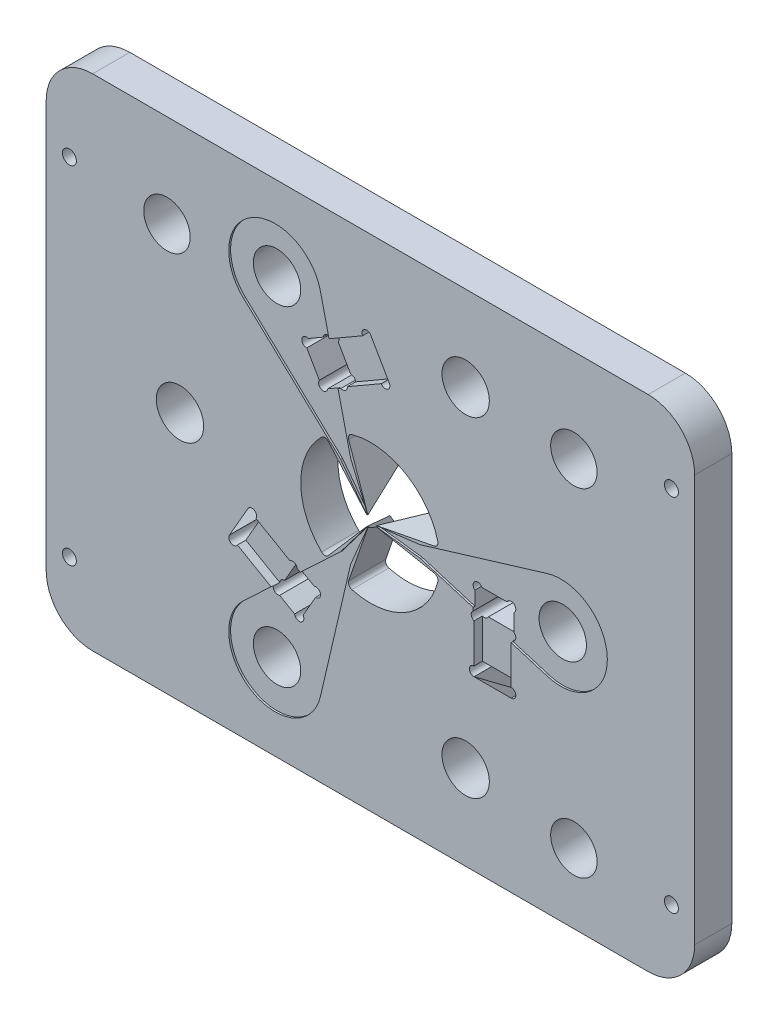
from build123d import *
from build123d.topology import SkipClean

# Parameters (mm, degrees)
SKETCH_1_W           = 76
SKETCH_1_H           = 60
EXTRUDE_1_DEPTH      = 4
CUT_EXTRUDE_1_DEPTH  = 0.5
SKETCH_3_R           = 2.55
CUT_EXTRUDE_2_DEPTH  = 49.541219597
SKETCH_5_R           = 2.55
CUT_EXTRUDE_4_DEPTH  = 49.579831206
SKETCH_6_W           = 76
SKETCH_6_H           = 60
CUT_EXTRUDE_5_DEPTH  = 10
CUT_EXTRUDE_6_DEPTH  = 45.244999717
SKETCH_8_R           = 0.75
CUT_EXTRUDE_7_DEPTH  = 45.244999717
EXTRUDE_START        = 0.5
SKETCH_10_R          = 2.55
EXTRUDE_2_DEPTH      = 0.5
CUT_EXTRUDE_9_DEPTH  = 45.244999717
SKETCH_13_R          = 2.5
CUT_EXTRUDE_10_DEPTH = 45.244999717
SKETCH_14_W          = 4
SKETCH_14_H          = 4.45
CUT_EXTRUDE_11_DEPTH = 0.9
CUT_EXTRUDE_12_DEPTH = 0.2
CUT_EXTRUDE_15_DEPTH = 4
CUT_EXTRUDE_16_DEPTH = 4
CUT_EXTRUDE_17_DEPTH = 4


with BuildPart() as part:
    # 草圖1 → 填料-伸長1 (new body)
    with BuildSketch(Plane.XY):
        Rectangle(SKETCH_1_W, SKETCH_1_H)
    extrude(amount=EXTRUDE_1_DEPTH)

    # 草圖2 → 除料-伸長1 (cut)
    with BuildSketch(Plane.XY.offset(4)):
        with BuildLine():
            Line((0.357380647, 0.004961492), (4.50941379, 0.523267787))
            ThreePointArc((4.50941379, 0.523267787), (5.349803134, 0.664770922), (6.175092484, 0.877314741))
            Line((6.175092484, 0.877314741), (19.047808057, 4.784468472))
            ThreePointArc((19.047808057, 4.784468472), (25.5, 0), (19.047808057, -4.784468472))
            Line((19.047808057, -4.784468472), (6.175092484, -0.877314741))
            ThreePointArc((6.175092484, -0.877314741), (5.349803134, -0.664770922), (4.50941379, -0.523267787))
            Line((4.50941379, -0.523267787), (0.357380647, -0.004961492))
            ThreePointArc((0.357380647, -0.004961492), (0.353, 0), (0.357380647, 0.004961492))
        make_face()
        with BuildLine():
            Line((-2.327769389, -5.786444332), (-5.380432788, -18.8881199))
            ThreePointArc((-5.380432788, -18.8881199), (-12.75, -22.083647797), (-13.667375269, -14.103651428))
            Line((-13.667375269, -14.103651428), (-3.847323094, -4.909129591))
            ThreePointArc((-3.847323094, -4.909129591), (-3.250610073, -4.300679958), (-2.707870091, -3.643633005))
            Line((-2.707870091, -3.643633005), (-0.182987102, -0.307019973))
            ThreePointArc((-0.182987102, -0.307019973), (-0.1765, -0.305706968), (-0.174393546, -0.311981465))
            Line((-0.174393546, -0.311981465), (-1.801543699, -4.166900792))
            ThreePointArc((-1.801543699, -4.166900792), (-2.09919306, -4.96545088), (-2.327769389, -5.786444332))
        make_face()
        with BuildLine():
            Line((-3.847323094, 4.909129591), (-13.667375269, 14.103651428))
            ThreePointArc((-13.667375269, 14.103651428), (-12.75, 22.083647797), (-5.380432788, 18.8881199))
            Line((-5.380432788, 18.8881199), (-2.327769389, 5.786444332))
            ThreePointArc((-2.327769389, 5.786444332), (-2.09919306, 4.96545088), (-1.801543699, 4.166900792))
            Line((-1.801543699, 4.166900792), (-0.174393546, 0.311981465))
            ThreePointArc((-0.174393546, 0.311981465), (-0.1765, 0.305706968), (-0.182987102, 0.307019973))
            Line((-0.182987102, 0.307019973), (-2.707870091, 3.643633005))
            ThreePointArc((-2.707870091, 3.643633005), (-3.250610073, 4.300679958), (-3.847323094, 4.909129591))
        make_face()
    extrude(amount=-CUT_EXTRUDE_1_DEPTH, mode=Mode.SUBTRACT)

    # 草圖3 → 除料-伸長2 (cut, through all)
    with BuildSketch(Plane.XY.offset(3.5)):
        with Locations((20.5, 0)):
            Circle(SKETCH_3_R)
        with Locations((-10.25, -17.753520778)):
            Circle(SKETCH_3_R)
        with Locations((-10.25, 17.753520778)):
            Circle(SKETCH_3_R)
    extrude(amount=-CUT_EXTRUDE_2_DEPTH, mode=Mode.SUBTRACT)

    # 草圖5 → 除料-伸長4 (cut, through all)
    with BuildSketch(Plane.XY.offset(4)):
        with Locations((-20.5, 0)):
            Circle(SKETCH_5_R)
        with Locations((10.25, 17.753520778)):
            Circle(SKETCH_5_R)
        with Locations((10.25, -17.753520778)):
            Circle(SKETCH_5_R)
    extrude(amount=-CUT_EXTRUDE_4_DEPTH, mode=Mode.SUBTRACT)

    # 草圖6 → 除料-伸長5 (cut)
    with BuildSketch(Plane.XY.offset(4)):
        Rectangle(SKETCH_6_W, SKETCH_6_H)
        with BuildLine():
            ThreePointArc((-34.9, 21.9), (-33.435533906, 25.435533906), (-29.9, 26.9))
            Line((-29.9, 26.9), (29.9, 26.9))
            ThreePointArc((29.9, 26.9), (33.435533906, 25.435533906), (34.9, 21.9))
            Line((34.9, 21.9), (34.9, -21.9))
            ThreePointArc((34.9, -21.9), (33.435533906, -25.435533906), (29.9, -26.9))
            Line((29.9, -26.9), (-29.9, -26.9))
            ThreePointArc((-29.9, -26.9), (-33.435533906, -25.435533906), (-34.9, -21.9))
            Line((-34.9, -21.9), (-34.9, 21.9))
        make_face(mode=Mode.SUBTRACT)
    extrude(amount=-CUT_EXTRUDE_5_DEPTH, mode=Mode.SUBTRACT)

    # 草圖7 → 除料-伸長6 (cut, through all)
    with BuildSketch(Plane.XY.offset(4)):
        with BuildLine():
            ThreePointArc((11.798296094, -0.228571429), (11.03056096, -0.065346), (11.05, -0.85))
            Line((11.05, -0.85), (11.05, -2.707142857))
            ThreePointArc((11.05, -2.707142857), (11.03056096, -3.491796857), (11.798296094, -3.328571429))
            Line((11.798296094, -3.328571429), (14.501703906, -3.328571429))
            ThreePointArc((14.501703906, -3.328571429), (15.26943904, -3.491796857), (15.25, -2.707142857))
            Line((15.25, -2.707142857), (15.25, -0.85))
            ThreePointArc((15.25, -0.85), (15.26943904, -0.065346), (14.501703906, -0.228571429))
            Line((14.501703906, -0.228571429), (11.798296094, -0.228571429))
        make_face()
        with BuildLine():
            ThreePointArc((-6.888878407, 13.631887408), (-7.578128224, 13.25639511), (-7.052903289, 12.673129695))
            Line((-7.052903289, 12.673129695), (-5.701199383, 10.331909853))
            ThreePointArc((-5.701199383, 10.331909853), (-5.458689184, 9.585419009), (-4.788878407, 9.994580712))
            Line((-4.788878407, 9.994580712), (-3.180545514, 10.92315214))
            ThreePointArc((-3.180545514, 10.92315214), (-2.491295697, 11.298644438), (-3.016520631, 11.881909853))
            Line((-3.016520631, 11.881909853), (-4.368224538, 14.223129695))
            ThreePointArc((-4.368224538, 14.223129695), (-4.610734737, 14.969620539), (-5.280545514, 14.560458836))
            Line((-5.280545514, 14.560458836), (-6.888878407, 13.631887408))
        make_face()
        with BuildLine():
            Line((15.15, -7.778571429), (11.15, -7.778571429))
            ThreePointArc((11.15, -7.778571429), (10.65, -8.278571429), (11.15, -8.778571429))
            Line((11.15, -8.778571429), (15.15, -8.778571429))
            ThreePointArc((15.15, -8.778571429), (15.65, -8.278571429), (15.15, -7.778571429))
        make_face()
        with BuildLine():
            Line((2.027465866, 14.045468966), (0.027465866, 17.509570582))
            ThreePointArc((0.027465866, 17.509570582), (-0.655546836, 17.692583284), (-0.838559538, 17.009570582))
            Line((-0.838559538, 17.009570582), (1.161440462, 13.545468966))
            ThreePointArc((1.161440462, 13.545468966), (1.844453164, 13.362456265), (2.027465866, 14.045468966))
        make_face()
        with BuildLine():
            Line((-6.261121593, -9.144580712), (-7.869454486, -8.216009283))
            ThreePointArc((-7.869454486, -8.216009283), (-8.539265263, -7.806847581), (-8.781775462, -8.553338424))
            Line((-8.781775462, -8.553338424), (-10.133479369, -10.894558267))
            ThreePointArc((-10.133479369, -10.894558267), (-10.658704303, -11.477823681), (-9.969454486, -11.853315979))
            Line((-9.969454486, -11.853315979), (-8.361121593, -12.781887408))
            ThreePointArc((-8.361121593, -12.781887408), (-7.691310816, -13.19104911), (-7.448800617, -12.444558267))
            Line((-7.448800617, -12.444558267), (-6.097096711, -10.103338424))
            ThreePointArc((-6.097096711, -10.103338424), (-5.571871776, -9.520073009), (-6.261121593, -9.144580712))
        make_face()
        with BuildLine():
            Line((-14.311440462, -9.230999153), (-12.311440462, -5.766897538))
            ThreePointArc((-12.311440462, -5.766897538), (-12.494453164, -5.083884836), (-13.177465866, -5.266897538))
            Line((-13.177465866, -5.266897538), (-15.177465866, -8.730999153))
            ThreePointArc((-15.177465866, -8.730999153), (-14.994453164, -9.414011855), (-14.311440462, -9.230999153))
        make_face()
    extrude(amount=-CUT_EXTRUDE_6_DEPTH, mode=Mode.SUBTRACT)

    # 草圖8 → 除料-伸長7 (cut, through all)
    with BuildSketch(Plane.XY):
        with Locations((-32.4, 17.9)):
            Circle(SKETCH_8_R)
        with Locations((32.4, 19.4)):
            Circle(SKETCH_8_R)
        with Locations((32.4, -19.4)):
            Circle(SKETCH_8_R)
        with Locations((-32.4, -19.4)):
            Circle(SKETCH_8_R)
    extrude(amount=CUT_EXTRUDE_7_DEPTH, mode=Mode.SUBTRACT)

    # 草圖10 → 填料-伸長2 (add)
    # profile 1 of 3: a face of its own
    with SkipClean():  # the faces are left unmerged after this step: merging them gives an invalid solid
        with BuildSketch(Plane.XY.offset(3.5).offset(EXTRUDE_START)):
            with BuildLine():
                Line((-3.847323094, -4.909129591), (-7.56618458, -8.391102245))
                Line((-7.56618458, -8.391102245), (-6.261121593, -9.144580712))
                ThreePointArc((-6.261121593, -9.144580712), (-5.571871776, -9.520073009), (-6.097096711, -10.103338424))
                Line((-6.097096711, -10.103338424), (-7.448800617, -12.444558267))
                ThreePointArc((-7.448800617, -12.444558267), (-7.691310816, -13.19104911), (-8.361121593, -12.781887408))
                Line((-8.361121593, -12.781887408), (-9.969454486, -11.853315979))
                ThreePointArc((-9.969454486, -11.853315979), (-10.48667114, -11.777022627), (-10.653138837, -11.281419712))
                Line((-10.653138837, -11.281419712), (-13.667375269, -14.103651428))
                ThreePointArc((-13.667375269, -14.103651428), (-12.75, -22.083647797), (-5.380432788, -18.8881199))
                Line((-5.380432788, -18.8881199), (-2.327769389, -5.786444332))
                ThreePointArc((-2.327769389, -5.786444332), (-2.09919306, -4.96545088), (-1.801543699, -4.166900792))
                Line((-1.801543699, -4.166900792), (-0.174393546, -0.311981465))
                ThreePointArc((-0.174393546, -0.311981465), (-0.1765, -0.305706968), (-0.182987102, -0.307019973))
                Line((-0.182987102, -0.307019973), (-2.707870091, -3.643633005))
                ThreePointArc((-2.707870091, -3.643633005), (-3.250610073, -4.300679958), (-3.847323094, -4.909129591))
            make_face()
            with Locations((-10.25, -17.753520778)):
                Circle(SKETCH_10_R, mode=Mode.SUBTRACT)
        # profile 2 of 3: a face of its own
        with BuildSketch(Plane.XY.offset(3.5).offset(EXTRUDE_START)):
            with BuildLine():
                Line((11.05, -2.356956933), (11.05, -0.85))
                ThreePointArc((11.05, -0.85), (11.03056096, -0.065346), (11.798296094, -0.228571429))
                Line((11.798296094, -0.228571429), (14.501703906, -0.228571429))
                ThreePointArc((14.501703906, -0.228571429), (15.26943904, -0.065346), (15.25, -0.85))
                Line((15.25, -0.85), (15.25, -2.707142857))
                ThreePointArc((15.25, -2.707142857), (15.442536346, -3.193212295), (15.09656548, -3.585179007))
                Line((15.09656548, -3.585179007), (19.047808057, -4.784468472))
                ThreePointArc((19.047808057, -4.784468472), (25.5, 0), (19.047808057, 4.784468472))
                Line((19.047808057, 4.784468472), (6.175092484, 0.877314741))
                ThreePointArc((6.175092484, 0.877314741), (5.349803134, 0.664770922), (4.50941379, 0.523267787))
                Line((4.50941379, 0.523267787), (0.357380647, 0.004961492))
                ThreePointArc((0.357380647, 0.004961492), (0.353, 0), (0.357380647, -0.004961492))
                Line((0.357380647, -0.004961492), (4.50941379, -0.523267787))
                ThreePointArc((4.50941379, -0.523267787), (5.349803134, -0.664770922), (6.175092484, -0.877314741))
                Line((6.175092484, -0.877314741), (11.05, -2.356956933))
            make_face()
            with Locations((20.5, 0)):
                Circle(SKETCH_10_R, mode=Mode.SUBTRACT)
        # profile 3 of 3: a face of its own
        with BuildSketch(Plane.XY.offset(3.5).offset(EXTRUDE_START)):
            with BuildLine():
                Line((-3.48381542, 10.748059178), (-4.788878407, 9.994580712))
                ThreePointArc((-4.788878407, 9.994580712), (-5.458689184, 9.585419009), (-5.701199383, 10.331909853))
                Line((-5.701199383, 10.331909853), (-7.052903289, 12.673129695))
                ThreePointArc((-7.052903289, 12.673129695), (-7.578128224, 13.25639511), (-6.888878407, 13.631887408))
                Line((-6.888878407, 13.631887408), (-5.280545514, 14.560458836))
                ThreePointArc((-5.280545514, 14.560458836), (-4.955865206, 14.970234922), (-4.443426643, 14.866598719))
                Line((-4.443426643, 14.866598719), (-5.380432788, 18.8881199))
                ThreePointArc((-5.380432788, 18.8881199), (-12.75, 22.083647797), (-13.667375269, 14.103651428))
                Line((-13.667375269, 14.103651428), (-3.847323094, 4.909129591))
                ThreePointArc((-3.847323094, 4.909129591), (-3.250610073, 4.300679958), (-2.707870091, 3.643633005))
                Line((-2.707870091, 3.643633005), (-0.182987102, 0.307019973))
                ThreePointArc((-0.182987102, 0.307019973), (-0.1765, 0.305706968), (-0.174393546, 0.311981465))
                Line((-0.174393546, 0.311981465), (-1.801543699, 4.166900792))
                ThreePointArc((-1.801543699, 4.166900792), (-2.09919306, 4.96545088), (-2.327769389, 5.786444332))
                Line((-2.327769389, 5.786444332), (-3.48381542, 10.748059178))
            make_face()
            with Locations((-10.25, 17.753520778)):
                Circle(SKETCH_10_R, mode=Mode.SUBTRACT)
        extrude(amount=-EXTRUDE_2_DEPTH)

    # 草圖11 → 除料-伸長9 (cut, through all)
    with SkipClean():  # the faces are left unmerged after this step: merging them gives an invalid solid
        with BuildSketch(Plane.XY.offset(4)):
            with BuildLine():
                Line((6.872043561, 1.260060854), (0.357368236, 0.004959927))
                ThreePointArc((0.357368236, 0.004959927), (0.353, 0), (0.357368236, -0.004959927))
                Line((0.357368236, -0.004959927), (6.872043561, -1.260060854))
                ThreePointArc((6.872043561, -1.260060854), (7.200064401, -1.483823168), (7.261558134, -1.87610593))
                ThreePointArc((7.261558134, -1.87610593), (3.75, -6.495190528), (-2.006023672, -7.22674678))
                ThreePointArc((-2.006023672, -7.22674678), (-2.315003643, -6.977350264), (-2.344777071, -6.581394727))
                Line((-2.344777071, -6.581394727), (-0.174388695, -0.311969934))
                ThreePointArc((-0.174388695, -0.311969934), (-0.1765, -0.305706968), (-0.18297954, -0.307010007))
                Line((-0.18297954, -0.307010007), (-4.52726649, -5.321333873))
                ThreePointArc((-4.52726649, -5.321333873), (-4.885060759, -5.493527096), (-5.255534463, -5.350640851))
                ThreePointArc((-5.255534463, -5.350640851), (-7.5, 0), (-5.255534463, 5.350640851))
                ThreePointArc((-5.255534463, 5.350640851), (-4.885060759, 5.493527096), (-4.52726649, 5.321333873))
                Line((-4.52726649, 5.321333873), (-0.18297954, 0.307010007))
                ThreePointArc((-0.18297954, 0.307010007), (-0.1765, 0.305706968), (-0.174388695, 0.311969934))
                Line((-0.174388695, 0.311969934), (-2.344777071, 6.581394727))
                ThreePointArc((-2.344777071, 6.581394727), (-2.315003643, 6.977350264), (-2.006023672, 7.22674678))
                ThreePointArc((-2.006023672, 7.22674678), (3.75, 6.495190528), (7.261558134, 1.87610593))
                ThreePointArc((7.261558134, 1.87610593), (7.200064401, 1.483823168), (6.872043561, 1.260060854))
            make_face()
        extrude(amount=-CUT_EXTRUDE_9_DEPTH, mode=Mode.SUBTRACT)

    # 草圖12 → 除料-旋轉1 (revolve, cut)
    with SkipClean():  # the faces are left unmerged after this step: merging them gives an invalid solid
        with BuildSketch(Plane(origin=(0, 0, 0), x_dir=(1, 0, 0), z_dir=(0, 1, 0))):
            Polygon((0.353, -4.18), (0.353, 0), (2.766324125, 0), align=None)
        revolve(axis=Axis((0, 0, 0), (0, 0, 1)), mode=Mode.SUBTRACT)

    # 草圖13 → 除料-伸長10 (cut, through all)
    with SkipClean():  # the faces are left unmerged after this step: merging them gives an invalid solid
        with BuildSketch(Plane(origin=(0, 0, 0), x_dir=(-1, 0, 0), z_dir=(0, 0, -1))):
            with Locations((-21.9, 16.9)):
                Circle(SKETCH_13_R)
            with Locations((21.9, 16.9)):
                Circle(SKETCH_13_R)
            with Locations((-21.9, -19.4)):
                Circle(SKETCH_13_R)
        extrude(amount=-CUT_EXTRUDE_10_DEPTH, mode=Mode.SUBTRACT)

    # 草圖14 → 除料-伸長11 (cut)
    with SkipClean():  # the faces are left unmerged after this step: merging them gives an invalid solid
        with BuildSketch(Plane.XY.offset(4)):
            with Locations((13.15, -5.553571429)):
                Rectangle(SKETCH_14_W, SKETCH_14_H)
            Polygon((-4.692372585, 14.784570582), (-2.692372585, 11.320468966), (1.161440462, 13.545468966), (-0.838559538, 17.009570582), align=None)
            Polygon((-14.311440462, -9.230999153), (-12.311440462, -5.766897538), (-8.457627415, -7.991897538), (-10.457627415, -11.455999153), align=None)
        extrude(amount=-CUT_EXTRUDE_11_DEPTH, mode=Mode.SUBTRACT)

    # 草圖15 → 除料-旋轉2 (revolve, cut)
    with SkipClean():  # the faces are left unmerged after this step: merging them gives an invalid solid
        with BuildSketch(Plane(origin=(0, 0, 0), x_dir=(1, 0, 0), z_dir=(0, 1, 0))):
            Polygon((0.353, 0), (0.353, -4.18), (0.553, -4.18), (2.966324125, 0), align=None)
        revolve(axis=Axis((0, 0, 0), (0, 0, 1)), mode=Mode.SUBTRACT)

    # 草圖16 → 除料-伸長12 (cut)
    with SkipClean():  # the faces are left unmerged after this step: merging them gives an invalid solid
        with BuildSketch(Plane.XY.offset(4)):
            with BuildLine():
                Line((0.357380647, 0.004961492), (5.358, 0.629198438))
                Line((5.358, 0.629198438), (19.047772641, 4.784457722))
                ThreePointArc((19.047772641, 4.784457722), (25.5, 0), (19.047772641, -4.784457722))
                Line((19.047772641, -4.784457722), (5.358, -0.629198438))
                Line((5.358, -0.629198438), (0.357380647, -0.004961492))
                ThreePointArc((0.357380647, -0.004961492), (0.353, 0), (0.357380647, 0.004961492))
            make_face()
            with BuildLine():
                Line((-0.182987102, -0.307019973), (-3.223901831, -4.325564895))
                Line((-3.223901831, -4.325564895), (-13.667348251, -14.103626131))
                ThreePointArc((-13.667348251, -14.103626131), (-12.75, -22.083647797), (-5.380424389, -18.888083853))
                Line((-5.380424389, -18.888083853), (-2.134098169, -4.954763332))
                Line((-2.134098169, -4.954763332), (-0.174393546, -0.311981465))
                ThreePointArc((-0.174393546, -0.311981465), (-0.1765, -0.305706968), (-0.182987102, -0.307019973))
            make_face()
            with BuildLine():
                Line((-0.174393546, 0.311981465), (-2.134098169, 4.954763332))
                Line((-2.134098169, 4.954763332), (-5.380424389, 18.888083853))
                ThreePointArc((-5.380424389, 18.888083853), (-12.75, 22.083647797), (-13.667348251, 14.103626131))
                Line((-13.667348251, 14.103626131), (-3.223901831, 4.325564895))
                Line((-3.223901831, 4.325564895), (-0.182987102, 0.307019973))
                ThreePointArc((-0.182987102, 0.307019973), (-0.1765, 0.305706968), (-0.174393546, 0.311981465))
            make_face()
        extrude(amount=-CUT_EXTRUDE_12_DEPTH, mode=Mode.SUBTRACT)

    # 草圖17 → 除料-伸長15 (cut)
    with SkipClean():  # the faces are left unmerged after this step: merging them gives an invalid solid
        with BuildSketch(Plane(origin=(11.15, 0, 0), x_dir=(0, 0, -1), z_dir=(1, 0, 0))):
            Polygon((0, -11.778571429), (0, -8.778571429), (-4, -8.778571429), align=None)
        extrude(amount=CUT_EXTRUDE_15_DEPTH, mode=Mode.SUBTRACT)

    # 草圖18 → 除料-伸長16 (cut)
    with SkipClean():  # the faces are left unmerged after this step: merging them gives an invalid solid
        with BuildSketch(Plane(origin=(-5.575, 9.656183252, 0), x_dir=(0.8660254037844387, 0.4999999999999999, 0), z_dir=(-0.49999999999999994, 0.8660254037844388, 0))):
            Polygon((8.778571429, -4), (8.778571429, 0), (11.778571429, 0), align=None)
        extrude(amount=CUT_EXTRUDE_16_DEPTH, mode=Mode.SUBTRACT)

    # 草圖19 → 除料-伸長17 (cut)
    with SkipClean():  # the faces are left unmerged after this step: merging them gives an invalid solid
        with BuildSketch(Plane(origin=(-5.575, -9.656183252, 0), x_dir=(-0.8660254037844386, 0.5000000000000003, 0), z_dir=(-0.5000000000000002, -0.8660254037844385, 0))):
            Polygon((8.778571429, -4), (8.778571429, 0), (11.778571429, 0), align=None)
        extrude(amount=CUT_EXTRUDE_17_DEPTH, mode=Mode.SUBTRACT)


solid = part.part
